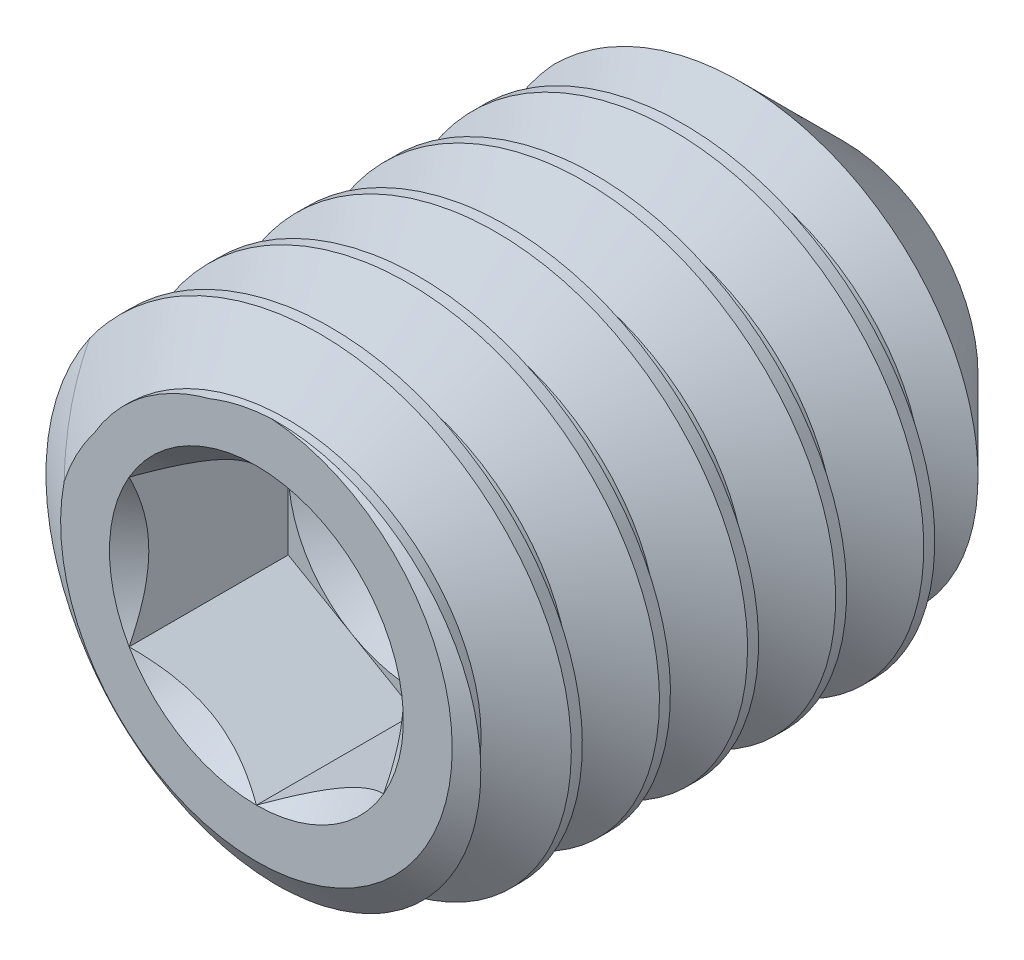
from build123d import *

# Parameters (mm, degrees)
CUT_SWEEP2_PITCH    = 0.45
CUT_EXTRUDE10_DEPTH = 0.8125


with BuildPart() as part:
    # Sketch22 → Revolve1 (revolve)
    with BuildSketch(Plane(origin=(0, 0, 0), x_dir=(0, 0, -1), z_dir=(1, 0, 0)), mode=Mode.PRIVATE) as revolve1_sk:
        Polygon((-1.294218417, 0), (-1.294218417, 1), (-1.119166532, 1.25), (1.140737716, 1.25), (1.705781583, 0.684956133), (1.294218417, 0), align=None)
    revolve(revolve1_sk.sketch.rotate(Axis((0, 0, -1.294218417), (0, 0, -1)), 180), axis=Axis((0, 0, -1.294218417), (0, 0, -1)))

    # Cut-Sweep2: arcs per turn and ends read off the stored shape
    # Cut-Sweep2: the profile of Sketch28 profile screwed along a right-hand helix through 7.666667 turns, 6 arcs to a turn; built about Z, then put on its axis
    cut_sweep2_z = Axis((0, 0, 0), (0, 0, 1))
    cut_sweep2_corners = [(1.2503, 1.091e-06, -0.112326732), (1.2503, 1.091e-06, -0.506423143), (0.957716426, 8.36e-07, -0.337499938), (0.957716426, 8.36e-07, -0.281249938)]
    with BuildLine(mode=Mode.PRIVATE) as cut_sweep2_profile:
        Line(cut_sweep2_corners[0], cut_sweep2_corners[1])
        Line(cut_sweep2_corners[1], cut_sweep2_corners[2])
        Line(cut_sweep2_corners[2], cut_sweep2_corners[3])
        Line(cut_sweep2_corners[3], cut_sweep2_corners[0])
    cut_sweep2_cap = Face(cut_sweep2_profile.wire())
    cut_sweep2_turn_angles = [0, 30, 60, 90, 120, 150, 180, 210, 240, 270, 300, 330, 360]
    cut_sweep2_turn_weights = [1, 0.8660254037844387, 1, 0.8660254037844387, 1, 0.8660254037844387, 1, 0.8660254037844387, 1, 0.8660254037844387, 1, 0.8660254037844387, 1]
    cut_sweep2_turn_rails = [Edge.make_bspline([Vector(p[0], p[1], 0).rotate(cut_sweep2_z, cut_sweep2_turn_angles[k]) / cut_sweep2_turn_weights[k] + Vector(0, 0, p[2] + CUT_SWEEP2_PITCH * cut_sweep2_turn_angles[k] / 360) for k in range(13)], [0, 0, 0, 1, 1, 2, 2, 3, 3, 4, 4, 5, 5, 6, 6, 6], 2, cut_sweep2_turn_weights) for p in cut_sweep2_corners]
    cut_sweep2_turn_sides = [Face.make_surface_from_curves(cut_sweep2_turn_rails[p[0]], cut_sweep2_turn_rails[p[1]]) for p in [(0, 1), (1, 2), (2, 3), (3, 0)]]
    cut_sweep2_last_angles = [2520, 2550, 2580, 2610, 2640, 2670, 2700, 2730, 2760]
    cut_sweep2_last_weights = [1, 0.8660254037844387, 1, 0.8660254037844387, 1, 0.8660254037844387, 1, 0.8660254037844168, 1]
    cut_sweep2_last_rails = [Edge.make_bspline([Vector(p[0], p[1], 0).rotate(cut_sweep2_z, cut_sweep2_last_angles[k]) / cut_sweep2_last_weights[k] + Vector(0, 0, p[2] + CUT_SWEEP2_PITCH * cut_sweep2_last_angles[k] / 360) for k in range(9)], [0, 0, 0, 1, 1, 2, 2, 3, 3, 4, 4, 4], 2, cut_sweep2_last_weights) for p in cut_sweep2_corners]
    cut_sweep2_last_sides = [Face.make_surface_from_curves(cut_sweep2_last_rails[p[0]], cut_sweep2_last_rails[p[1]]) for p in [(0, 1), (1, 2), (2, 3), (3, 0)]]
    cut_sweep2 = Plane(origin=(0, 0, -1.705781583), x_dir=(1, 0, 0), z_dir=(0, 0, 1)) * Solid(Shell([*[p.moved(Location((0, 0, CUT_SWEEP2_PITCH * i))) for i in range(7) for p in cut_sweep2_turn_sides], *cut_sweep2_last_sides, cut_sweep2_cap, cut_sweep2_cap.rotate(cut_sweep2_z, 2760).moved(Location((0, 0, CUT_SWEEP2_PITCH * 2760 / 360)))]))
    add(cut_sweep2, mode=Mode.SUBTRACT)

    # Sketch23 → Cut-Extrude10 (cut)
    with BuildSketch(Plane.XY.offset(1.294218417)):
        Polygon((0, 0.75055535), (-0.65, 0.375277675), (-0.65, -0.375277675), (0, -0.75055535), (0.65, -0.375277675), (0.65, 0.375277675), align=None)
    extrude(amount=-CUT_EXTRUDE10_DEPTH, mode=Mode.SUBTRACT)

    # Cut-Extrude11 cone 1 section (through the dimple's axis) → Cut-Extrude11 (revolve, cut)
    with BuildSketch(Plane(origin=(0, 0, 1.294218417), x_dir=(0, -1, 0), z_dir=(1, 0, 0))):
        Polygon((0, 0), (0.75055535, 0), (0, 0.75055535), align=None)
    revolve(axis=Axis((0, 0, 1.294218417), (0, 0, -1)), mode=Mode.SUBTRACT)

    # Cut-Extrude12 cone 1 section (through the dimple's axis) → Cut-Extrude12 (revolve, cut)
    with BuildSketch(Plane(origin=(0, 0, 0.481718417), x_dir=(0, -1, 0), z_dir=(1, 0, 0))):
        Polygon((0, 0), (0.65, 0), (0, 0.375277675), align=None)
    revolve(axis=Axis((0, 0, 0.481718417), (0, 0, -1)), mode=Mode.SUBTRACT)


solid = part.part
